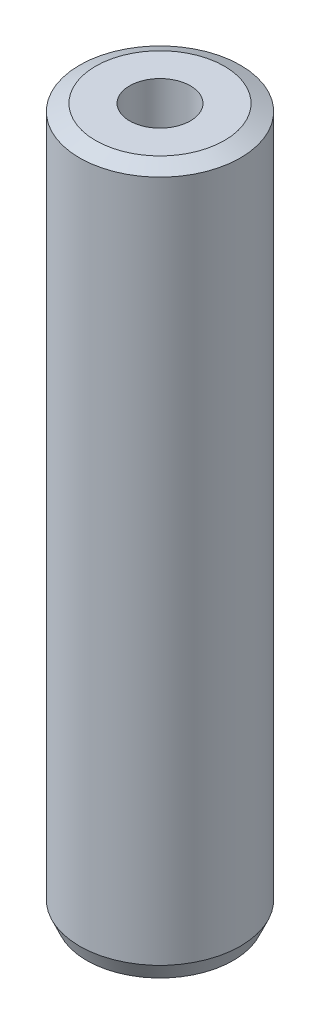
from build123d import *
from OCP.BRepFilletAPI import BRepFilletAPI_MakeChamfer

# Parameters (mm, degrees)
SKETCH1_R           = 55
BOSS_EXTRUDE1_DEPTH = 482.721061348
SKETCH2_R           = 20.801482247
CUT_EXTRUDE1_DEPTH  = 489.947464529
CHAMFER1_SIZE       = 4.846382443
CHAMFER1_SIZE2      = 10.928753373


with BuildPart() as part:
    # Sketch1 → Boss-Extrude1 (new body)
    with BuildSketch(Plane(origin=(0, 0, 0), x_dir=(1, 0, 0), z_dir=(0, 1, 0))):
        Circle(SKETCH1_R)
    extrude(amount=BOSS_EXTRUDE1_DEPTH)

    # Sketch2 → Cut-Extrude1 (cut, through all)
    with BuildSketch(Plane(origin=(0, 0, 0), x_dir=(1, 0, 0), z_dir=(0, 1, 0))):
        Circle(SKETCH2_R)
    extrude(amount=CUT_EXTRUDE1_DEPTH, mode=Mode.SUBTRACT)

    # Chamfer1: one chamfer whose edges measure the first distance from different faces: ONE call of the kernel's chamfer builder (chamfer() names one face for all edges)
    chamfer1_edges_1 = [part.edges().sort_by_distance(p)[0] for p in [
        (-55, 482.721061348, 0),
    ]]
    chamfer1_side_1 = [part.faces().sort_by_distance(p)[0] for p in [
        (-55, 241.360530674, 0),
    ]]
    chamfer1_edges_2 = [part.edges().sort_by_distance(p)[0] for p in [
        (-55, 0, 0),
    ]]
    chamfer1_side_2 = [part.faces().sort_by_distance(p)[0] for p in [
        (-53.444365081, 0, 0),
    ]]
    chamfer1 = BRepFilletAPI_MakeChamfer(part.part.solid().wrapped)
    for e in chamfer1_edges_1:
        chamfer1.Add(CHAMFER1_SIZE, CHAMFER1_SIZE2, e.wrapped, chamfer1_side_1[0].wrapped)  # the first distance lies on this face
    for e in chamfer1_edges_2:
        chamfer1.Add(CHAMFER1_SIZE, CHAMFER1_SIZE2, e.wrapped, chamfer1_side_2[0].wrapped)  # the first distance lies on this face
    add(Compound.cast(chamfer1.Shape()), mode=Mode.REPLACE)


solid = part.part
